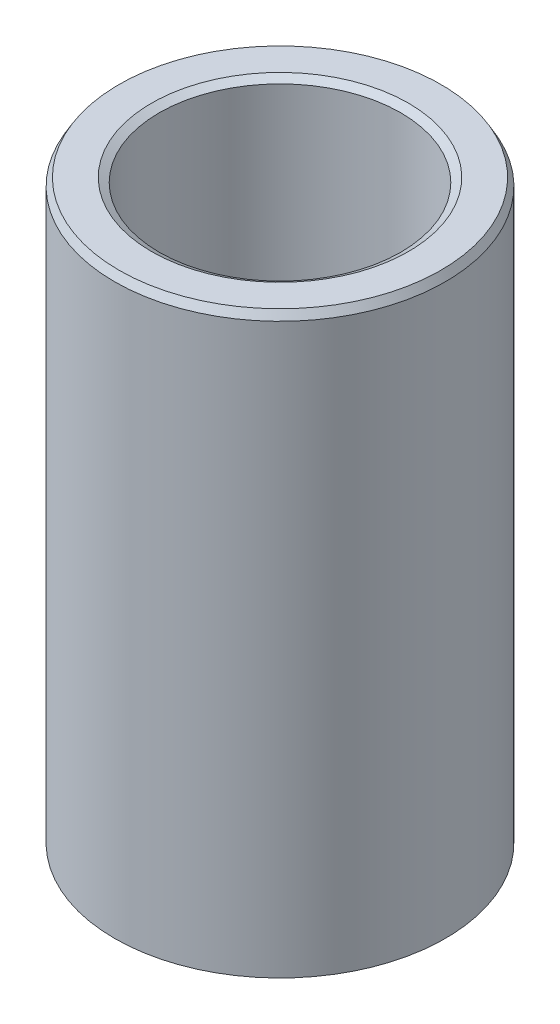
from build123d import *
from OCP.BRepFilletAPI import BRepFilletAPI_MakeChamfer

# Parameters (mm, degrees)
SKETCH1_R           = 20
BOSS_EXTRUDE1_DEPTH = 70.238067808
SKETCH2_R           = 14.605157854
CUT_EXTRUDE1_DEPTH  = 76.71912684
CHAMFER1_SIZE       = 0.934888798
CHAMFER1_SIZE2      = 0.539758299


with BuildPart() as part:
    # Sketch1 → Boss-Extrude1 (new body)
    with BuildSketch(Plane(origin=(0, 0, 0), x_dir=(1, 0, 0), z_dir=(0, 1, 0))):
        Circle(SKETCH1_R)
    extrude(amount=BOSS_EXTRUDE1_DEPTH)

    # Sketch2 → Cut-Extrude1 (cut, through all)
    with BuildSketch(Plane(origin=(0, 0, 0), x_dir=(1, 0, 0), z_dir=(0, 1, 0))):
        Circle(SKETCH2_R)
    extrude(amount=CUT_EXTRUDE1_DEPTH, mode=Mode.SUBTRACT)

    # Chamfer1: one chamfer whose edges measure the first distance from different faces: ONE call of the kernel's chamfer builder (chamfer() names one face for all edges)
    chamfer1_edges_1 = [part.edges().sort_by_distance(p)[0] for p in [
        (-14.605157854, 70.238067808, 0),
    ]]
    chamfer1_side_1 = [part.faces().sort_by_distance(p)[0] for p in [
        (-19.434314575, 70.238067808, 0),
    ]]
    chamfer1_edges_2 = [part.edges().sort_by_distance(p)[0] for p in [
        (-14.605157854, 0, 0),
    ]]
    chamfer1_side_2 = [part.faces().sort_by_distance(p)[0] for p in [
        (-14.605157854, 35.119033904, 0),
    ]]
    chamfer1_edges_3 = [part.edges().sort_by_distance(p)[0] for p in [
        (-20, 0, 0),
    ]]
    chamfer1_side_3 = [part.faces().sort_by_distance(p)[0] for p in [
        (-19.434314575, 0, 0),
    ]]
    chamfer1_edges_4 = [part.edges().sort_by_distance(p)[0] for p in [
        (-20, 70.238067808, 0),
    ]]
    chamfer1_side_4 = [part.faces().sort_by_distance(p)[0] for p in [
        (-20, 35.119033904, 0),
    ]]
    chamfer1 = BRepFilletAPI_MakeChamfer(part.part.solid().wrapped)
    for e in chamfer1_edges_1:
        chamfer1.Add(CHAMFER1_SIZE, CHAMFER1_SIZE2, e.wrapped, chamfer1_side_1[0].wrapped)  # the first distance lies on this face
    for e in chamfer1_edges_2:
        chamfer1.Add(CHAMFER1_SIZE, CHAMFER1_SIZE2, e.wrapped, chamfer1_side_2[0].wrapped)  # the first distance lies on this face
    for e in chamfer1_edges_3:
        chamfer1.Add(CHAMFER1_SIZE, CHAMFER1_SIZE2, e.wrapped, chamfer1_side_3[0].wrapped)  # the first distance lies on this face
    for e in chamfer1_edges_4:
        chamfer1.Add(CHAMFER1_SIZE, CHAMFER1_SIZE2, e.wrapped, chamfer1_side_4[0].wrapped)  # the first distance lies on this face
    add(Compound.cast(chamfer1.Shape()), mode=Mode.REPLACE)


solid = part.part
